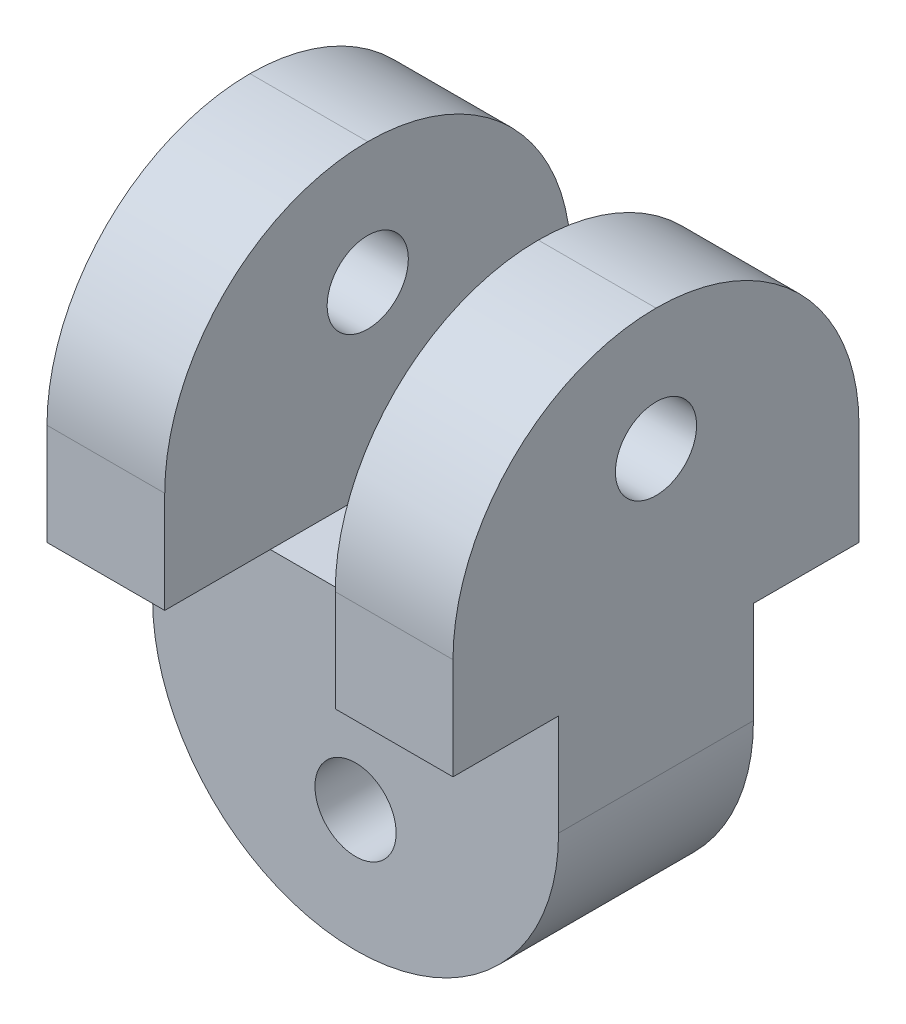
from build123d import *

# Parameters (mm, degrees)
SKETCH1_R           = 1
BOSS_EXTRUDE1_DEPTH = 10
SKETCH2_R           = 1
SKETCH2_W           = 2.6
SKETCH2_H           = 7.5
CUT_EXTRUDE1_DEPTH  = 10
FILLET1_R           = 5


with BuildPart() as part:
    # Sketch1 → Boss-Extrude1 (new body)
    with BuildSketch(Plane.XY):
        Polygon((-5, -7.5), (5, -7.5), (5, 7.5), (2.1, 7.5), (2.1, 0), (-2.1, 0), (-2.1, 7.5), (-5, 7.5), align=None)
        with Locations((0, -4.5)):
            Circle(SKETCH1_R, mode=Mode.SUBTRACT)
    extrude(amount=BOSS_EXTRUDE1_DEPTH)

    # Sketch2 → Cut-Extrude1 (cut)
    with BuildSketch(Plane(origin=(5, 0, 0), x_dir=(0, 0, -1), z_dir=(1, 0, 0))):
        with Locations(Location((-5, 4.5, 0), (0, 0, 90))):
            Circle(SKETCH2_R)
        with Locations((-8.7, -3.75)):
            Rectangle(SKETCH2_W, SKETCH2_H)
        with Locations((-1.3, -3.75)):
            Rectangle(SKETCH2_W, SKETCH2_H)
    extrude(amount=-CUT_EXTRUDE1_DEPTH, mode=Mode.SUBTRACT)

    # Fillet1
    fillet1_edges = [part.edges().sort_by_distance(p)[0] for p in [
        (-5, -7.5, 5),
        (5, -7.5, 5),
        (-3.55, 7.5, 0),
        (3.55, 7.5, 0),
        (3.55, 7.5, 10),
        (-3.55, 7.5, 10),
    ]]
    fillet(fillet1_edges, radius=FILLET1_R - 0.0001)  # a hair under: the kernel refuses the full size


solid = part.part
